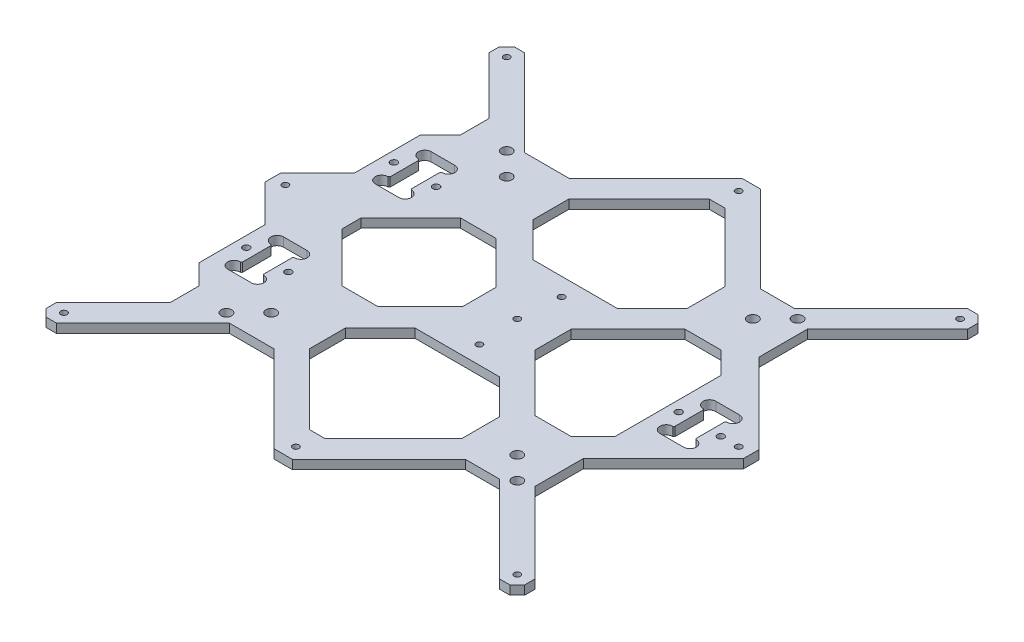
from build123d import *

# Parameters (mm, degrees)
SKETCH2_R            = 1.5
SKETCH2_R_2          = 1.6
BOSS_EXTRUDE2_DEPTH  = 4.25
SKETCH4_R            = 2.5
HOLES_TO_DRILL_DEPTH = 416.108494854


with BuildPart() as part:
    # Sketch2 → Boss-Extrude2 (new body)
    with BuildSketch(Plane(origin=(0, 0, 0), x_dir=(1, 0, 0), z_dir=(0, 1, 0))):
        Polygon((225.400116, 255), (184.400116, 296), (175.599884, 296), (134.599884, 255), (113.485281374, 255), (72.485281374, 296), (67.514830223, 296), (64, 292.485169777), (64, 287.514718626), (91, 260.514718626), (91, 247), (81.5, 237.5), (81.5, 206.239105), (64, 188.739105), (64, 181.260895), (81.5, 163.760895), (81.5, 132.5), (91, 123), (91, 109.485281374), (64, 82.485281374), (64, 77.514830223), (67.514830223, 74), (72.485281374, 74), (113.485281374, 115), (134.599884, 115), (175.599884, 74), (184.400116, 74), (225.400116, 115), (241.514718626, 115), (282.514718626, 74), (287.485169777, 74), (291, 77.514830223), (291, 82.485281374), (253, 120.485281374), (253, 143.333039), (291, 181.333039), (291, 188.666961), (253, 226.666961), (253, 249.514718626), (291, 287.514718626), (291, 292.485169777), (287.485169777, 296), (282.514718626, 296), (241.514718626, 255), align=None)
        with Locations((70, 80)):
            Circle(SKETCH2_R, mode=Mode.SUBTRACT)
        with Locations((180, 80)):
            Circle(SKETCH2_R, mode=Mode.SUBTRACT)
        with Locations((86.5, 150)):
            Circle(SKETCH2_R_2, mode=Mode.SUBTRACT)
        with Locations((70, 185)):
            Circle(SKETCH2_R, mode=Mode.SUBTRACT)
        Polygon((176.317383, 90.266846), (143, 123.584229), (143, 140.433686), (159.566314, 157), (199.51474, 157), (216, 140.51474), (216, 122.570419884), (183.682617, 90.253036884), align=None, mode=Mode.SUBTRACT)
        with BuildLine():
            Line((102.000000013, 157.25), (101.500000013, 156.75))
            Line((101.500000013, 156.75), (101.500000013, 143.25))
            Line((101.500000013, 143.25), (102.000000013, 142.75))
            Line((102.000000013, 142.75), (102.100000157, 142.75))
            ThreePointArc((102.100000157, 142.75), (105.1, 139.75), (102.100000157, 136.75))
            Line((102.100000157, 136.75), (90.899999843, 136.75))
            ThreePointArc((90.899999843, 136.75), (87.9, 139.75), (90.899999843, 142.75))
            Line((90.899999843, 142.75), (90.999999987, 142.75))
            Line((90.999999987, 142.75), (91.499999987, 143.25))
            Line((91.499999987, 143.25), (91.499999987, 156.75))
            Line((91.499999987, 156.75), (90.999999987, 157.25))
            Line((90.999999987, 157.25), (90.899999843, 157.25))
            ThreePointArc((90.899999843, 157.25), (87.9, 160.25), (90.899999843, 163.25))
            Line((90.899999843, 163.25), (102.100000157, 163.25))
            ThreePointArc((102.100000157, 163.25), (105.100000157, 160.25), (102.100000157, 157.25))
            Line((102.100000157, 157.25), (102.000000013, 157.25))
        make_face(mode=Mode.SUBTRACT)
        with Locations((106.5, 150)):
            Circle(SKETCH2_R_2, mode=Mode.SUBTRACT)
        with Locations((181.5, 165.5)):
            Circle(SKETCH2_R, mode=Mode.SUBTRACT)
        with Locations((285, 80)):
            Circle(SKETCH2_R, mode=Mode.SUBTRACT)
        with Locations((86.5, 220)):
            Circle(SKETCH2_R_2, mode=Mode.SUBTRACT)
        Polygon((162, 192.97703218), (162, 177.02296782), (141.97703218, 157), (124.999970007, 157), (101.5, 180.5), (101.5, 189.5), (124.999970007, 213), (141.97703218, 213), align=None, mode=Mode.SUBTRACT)
        with BuildLine():
            Line((102.000000013, 227.25), (101.500000013, 226.75))
            Line((101.500000013, 226.75), (101.500000013, 213.25))
            Line((101.500000013, 213.25), (102.000000013, 212.75))
            Line((102.000000013, 212.75), (102.100000157, 212.75))
            ThreePointArc((102.100000157, 212.75), (105.1, 209.75), (102.100000157, 206.75))
            Line((102.100000157, 206.75), (90.899999843, 206.75))
            ThreePointArc((90.899999843, 206.75), (87.9, 209.75), (90.899999843, 212.75))
            Line((90.899999843, 212.75), (90.999999987, 212.75))
            Line((90.999999987, 212.75), (91.499999987, 213.25))
            Line((91.499999987, 213.25), (91.499999987, 226.75))
            Line((91.499999987, 226.75), (90.999999987, 227.25))
            Line((90.999999987, 227.25), (90.899999843, 227.25))
            ThreePointArc((90.899999843, 227.25), (87.9, 230.25), (90.899999843, 233.25))
            Line((90.899999843, 233.25), (102.100000157, 233.25))
            ThreePointArc((102.100000157, 233.25), (105.100000157, 230.25), (102.100000157, 227.25))
            Line((102.100000157, 227.25), (102.000000013, 227.25))
        make_face(mode=Mode.SUBTRACT)
        with Locations((106.5, 220)):
            Circle(SKETCH2_R_2, mode=Mode.SUBTRACT)
        with Locations((180, 185)):
            Circle(SKETCH2_R, mode=Mode.SUBTRACT)
        with Locations((181.5, 204.5)):
            Circle(SKETCH2_R, mode=Mode.SUBTRACT)
        Polygon((143, 229.566314), (143, 246.415771), (176.317383, 279.733154), (183.682617, 279.746963116), (216, 247.429580116), (216, 229.48526), (199.51474, 213), (159.566314, 213), align=None, mode=Mode.SUBTRACT)
        with Locations((70, 290)):
            Circle(SKETCH2_R, mode=Mode.SUBTRACT)
        with Locations((180, 290)):
            Circle(SKETCH2_R, mode=Mode.SUBTRACT)
        Polygon((240.98529, 220.529449), (251.5, 210.014709), (251.5, 159.985291), (240.98529, 149.470551), (224.014709, 149.470551), (197, 176.48526), (197, 193.51474), (224.014709, 220.529449), align=None, mode=Mode.SUBTRACT)
        with Locations((256.5, 185)):
            Circle(SKETCH2_R_2, mode=Mode.SUBTRACT)
        with BuildLine():
            Line((272.000000013, 192.25), (271.500000013, 191.75))
            Line((271.500000013, 191.75), (271.500000013, 178.25))
            Line((271.500000013, 178.25), (272.000000013, 177.75))
            Line((272.000000013, 177.75), (272.100000157, 177.75))
            ThreePointArc((272.100000157, 177.75), (275.100000157, 174.75), (272.100000157, 171.75))
            Line((272.100000157, 171.75), (260.899999843, 171.75))
            ThreePointArc((260.899999843, 171.75), (257.9, 174.75), (260.899999843, 177.75))
            Line((260.899999843, 177.75), (260.999999987, 177.75))
            Line((260.999999987, 177.75), (261.499999987, 178.25))
            Line((261.499999987, 178.25), (261.499999987, 191.75))
            Line((261.499999987, 191.75), (260.999999987, 192.25))
            Line((260.999999987, 192.25), (260.899999843, 192.25))
            ThreePointArc((260.899999843, 192.25), (257.9, 195.25), (260.899999843, 198.25))
            Line((260.899999843, 198.25), (272.100000157, 198.25))
            ThreePointArc((272.100000157, 198.25), (275.100000157, 195.25), (272.100000157, 192.25))
            Line((272.100000157, 192.25), (272.000000013, 192.25))
        make_face(mode=Mode.SUBTRACT)
        with Locations((276.5, 185)):
            Circle(SKETCH2_R_2, mode=Mode.SUBTRACT)
        with Locations((285, 185)):
            Circle(SKETCH2_R, mode=Mode.SUBTRACT)
        with Locations((285, 290)):
            Circle(SKETCH2_R, mode=Mode.SUBTRACT)
    extrude(amount=BOSS_EXTRUDE2_DEPTH)

    # Sketch4 → Holes-to-drill (cut, through all)
    with BuildSketch(Plane(origin=(0, 4.25, 0), x_dir=(1, 0, 0), z_dir=(0, 1, 0))):
        with Locations((119.143977091, 129.143977091)):
            Circle(SKETCH4_R)
        with Locations((108.537375373, 118.537375373)):
            Circle(SKETCH4_R)
        with Locations((108.537375373, 251.462624627)):
            Circle(SKETCH4_R)
        with Locations((119.143977091, 240.856022909)):
            Circle(SKETCH4_R)
        with Locations((235.856022909, 240.856022909)):
            Circle(SKETCH4_R)
        with Locations((246.462624627, 251.462624627)):
            Circle(SKETCH4_R)
        with Locations((235.856022909, 129.143977091)):
            Circle(SKETCH4_R)
        with Locations((246.462624627, 118.537375373)):
            Circle(SKETCH4_R)
    extrude(amount=-HOLES_TO_DRILL_DEPTH, mode=Mode.SUBTRACT)


solid = part.part
